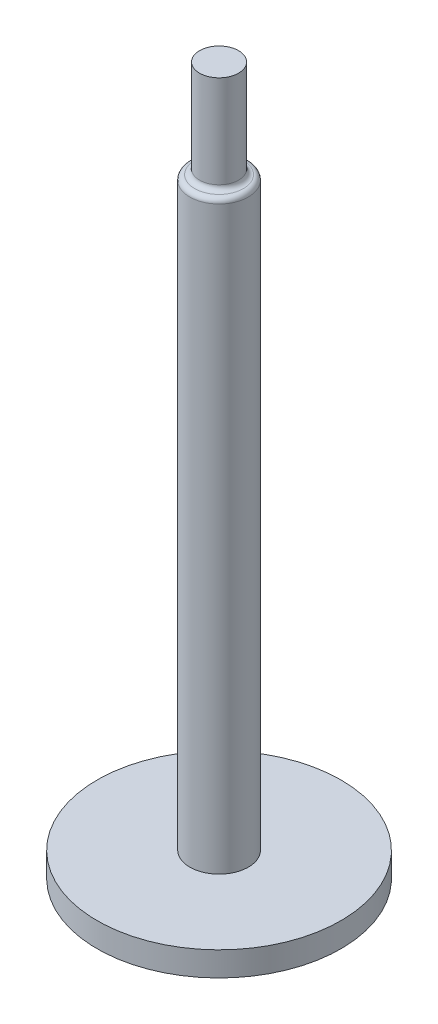
from build123d import *

# Parameters (mm, degrees)
SKETCH1_R           = 4
BOSS_EXTRUDE1_DEPTH = 10
SKETCH2_R           = 6
BOSS_EXTRUDE2_DEPTH = 120
SKETCH3_R           = 25
BOSS_EXTRUDE3_DEPTH = 5
SKETCH4_R           = 6
BOSS_EXTRUDE4_DEPTH = 5
FILLET2_R           = 1


with BuildPart() as part:
    # Sketch1 → Boss-Extrude1 (new, symmetric)
    with BuildSketch(Plane(origin=(0, 0, 0), x_dir=(1, 0, 0), z_dir=(0, 1, 0))):
        with Locations(Location((0, 0, 0), (0, 0, 270))):
            Circle(SKETCH1_R)
    extrude(amount=BOSS_EXTRUDE1_DEPTH, both=True)

    # Sketch2 → Boss-Extrude2 (add)
    with BuildSketch(Plane.XZ.offset(10)):
        with Locations(Location((0, 0, 0), (0, 0, 270))):
            Circle(SKETCH2_R)
    extrude(amount=BOSS_EXTRUDE2_DEPTH)

    # Sketch3 → Boss-Extrude3 (add)
    with BuildSketch(Plane.XZ.offset(130)):
        with Locations(Location((0, 0, 0), (0, 0, 270))):
            Circle(SKETCH3_R)
    extrude(amount=BOSS_EXTRUDE3_DEPTH)

    # Sketch4 → Boss-Extrude4 (add)
    with BuildSketch(Plane.XZ.offset(135)):
        with Locations(Location((0, 0, 0), (0, 0, 270))):
            Circle(SKETCH4_R)
    extrude(amount=BOSS_EXTRUDE4_DEPTH)

    # Fillet2
    fillet2_edges = [part.edges().sort_by_distance(p)[0] for p in [
        (0, -10, -4),
        (0, -10, 6),
    ]]
    fillet(fillet2_edges, radius=FILLET2_R - 0.0001)  # a hair under: the kernel refuses the full size


solid = part.part
